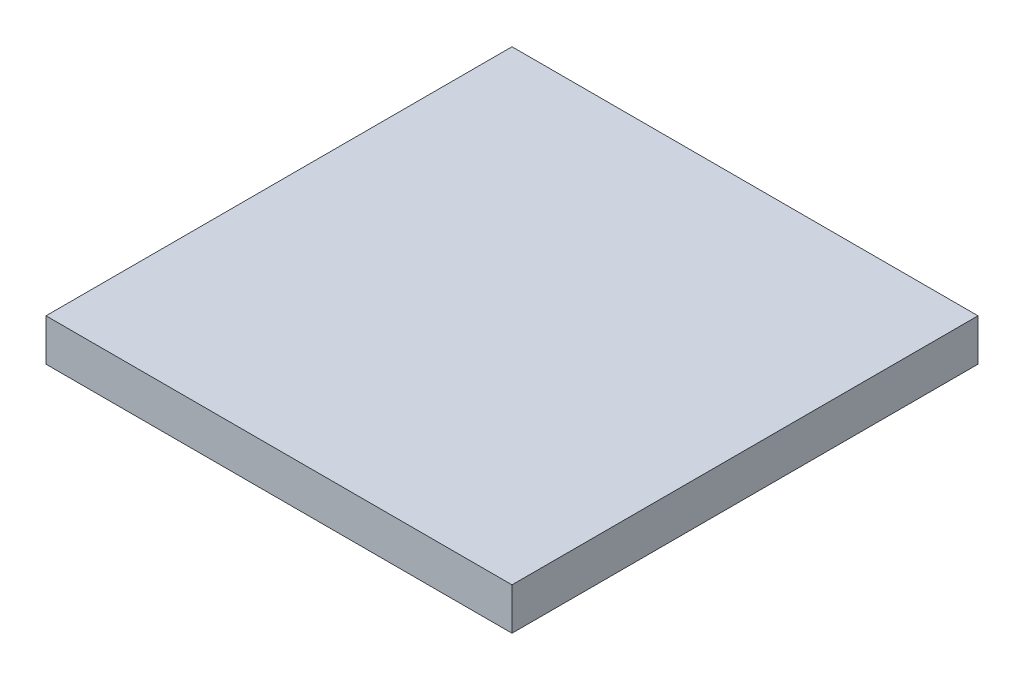
from build123d import *

# Parameters (mm, degrees)
SKETCH1_W           = 40
SKETCH1_H           = 40
BOSS_EXTRUDE1_DEPTH = 1.8


with BuildPart() as part:
    # Sketch1 → Boss-Extrude1 (new, symmetric)
    with BuildSketch(Plane(origin=(0, 0, 0), x_dir=(1, 0, 0), z_dir=(0, 1, 0))):
        Rectangle(SKETCH1_W, SKETCH1_H)
    extrude(amount=BOSS_EXTRUDE1_DEPTH, both=True)


solid = part.part
